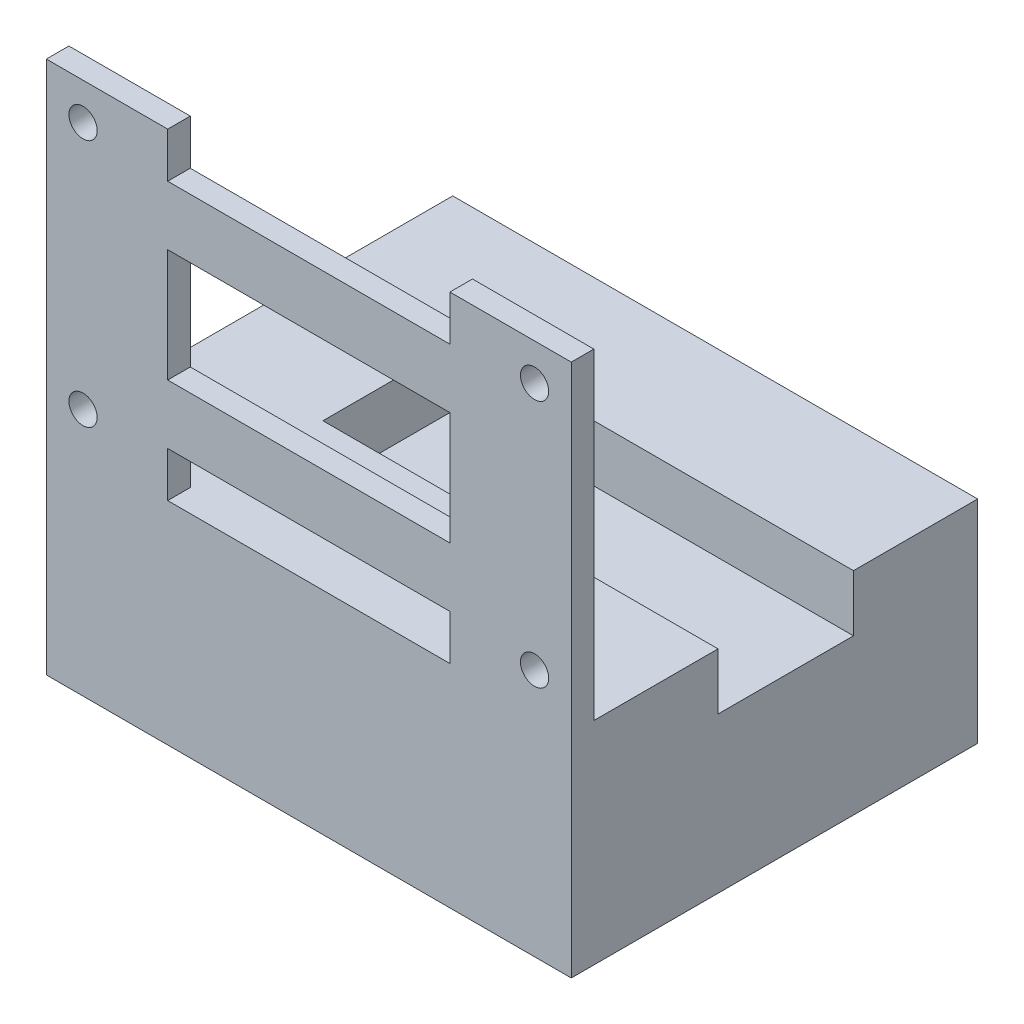
from build123d import *

# Parameters (mm, degrees)
SKETCH1_W           = 46.5
SKETCH1_H           = 34
BOSS_EXTRUDE1_DEPTH = 13.75
SKETCH2_W           = 46.5
SKETCH2_H           = 42.25
BOSS_EXTRUDE2_DEPTH = 2
CUT_EXTRUDE1_REACH  = 62.18
SKETCH3_R           = 1.25
SKETCH3_W           = 25
SKETCH3_H           = 10
SKETCH4_W           = 35
SKETCH4_H           = 12
CUT_EXTRUDE2_DEPTH  = 5
SKETCH6_W           = 46.5
SKETCH6_H           = 36
SKETCH6_R           = 2
BOSS_EXTRUDE3_DEPTH = 5
SKETCH7_W           = 25
SKETCH7_H           = 4
CUT_EXTRUDE3_DEPTH  = 10


with BuildPart() as part:
    # Sketch1 → Boss-Extrude1 (new body)
    with BuildSketch(Plane(origin=(0, 0, 0), x_dir=(1, 0, 0), z_dir=(0, 1, 0))):
        Rectangle(SKETCH1_W, SKETCH1_H)
    extrude(amount=BOSS_EXTRUDE1_DEPTH)

    # Sketch2 → Boss-Extrude2 (add)
    with BuildSketch(Plane.XY.offset(17)):
        with Locations((0, 21.125)):
            Rectangle(SKETCH2_W, SKETCH2_H)
    extrude(amount=BOSS_EXTRUDE2_DEPTH)

    # Sketch3 → Cut-Extrude1 (cut, up to next)
    with BuildSketch(Plane.XY.offset(19), mode=Mode.PRIVATE) as cut_extrude1_sk1:
        with Locations((-20, 39)):
            Circle(SKETCH3_R)
    cut_extrude1_tool1 = extrude(cut_extrude1_sk1.sketch, amount=-CUT_EXTRUDE1_REACH, mode=Mode.PRIVATE) & part.part
    # Sketch3 → Cut-Extrude1 (cut, up to next)
    with BuildSketch(Plane.XY.offset(19), mode=Mode.PRIVATE) as cut_extrude1_sk2:
        with Locations((20, 39)):
            Circle(SKETCH3_R)
    cut_extrude1_tool2 = extrude(cut_extrude1_sk2.sketch, amount=-CUT_EXTRUDE1_REACH, mode=Mode.PRIVATE) & part.part
    # Sketch3 → Cut-Extrude1 (cut, up to next)
    with BuildSketch(Plane.XY.offset(19), mode=Mode.PRIVATE) as cut_extrude1_sk3:
        with Locations((20, 17)):
            Circle(SKETCH3_R)
    cut_extrude1_tool3 = extrude(cut_extrude1_sk3.sketch, amount=-CUT_EXTRUDE1_REACH, mode=Mode.PRIVATE) & part.part
    # Sketch3 → Cut-Extrude1 (cut, up to next)
    with BuildSketch(Plane.XY.offset(19), mode=Mode.PRIVATE) as cut_extrude1_sk4:
        with Locations((-20, 17)):
            Circle(SKETCH3_R)
    cut_extrude1_tool4 = extrude(cut_extrude1_sk4.sketch, amount=-CUT_EXTRUDE1_REACH, mode=Mode.PRIVATE) & part.part
    # Sketch3 → Cut-Extrude1 (cut, up to next)
    with BuildSketch(Plane.XY.offset(19), mode=Mode.PRIVATE) as cut_extrude1_sk5:
        with Locations((0, 28)):
            Rectangle(SKETCH3_W, SKETCH3_H)
    cut_extrude1_tool5 = extrude(cut_extrude1_sk5.sketch, amount=-CUT_EXTRUDE1_REACH, mode=Mode.PRIVATE) & part.part
    add(cut_extrude1_tool1.solids().sort_by_distance((-20, 39, 19))[0], mode=Mode.SUBTRACT)
    add(cut_extrude1_tool2.solids().sort_by_distance((20, 39, 19))[0], mode=Mode.SUBTRACT)
    add(cut_extrude1_tool3.solids().sort_by_distance((20, 17, 19))[0], mode=Mode.SUBTRACT)
    add(cut_extrude1_tool4.solids().sort_by_distance((-20, 17, 19))[0], mode=Mode.SUBTRACT)
    add(cut_extrude1_tool5.solids().sort_by_distance((0, 28, 19))[0], mode=Mode.SUBTRACT)

    # Sketch4 → Cut-Extrude2 (cut)
    with BuildSketch(Plane(origin=(0, 13.75, 0), x_dir=(1, 0, 0), z_dir=(0, 1, 0))):
        with Locations((5.75, 0)):
            Rectangle(SKETCH4_W, SKETCH4_H)
    extrude(amount=-CUT_EXTRUDE2_DEPTH, mode=Mode.SUBTRACT)

    # Sketch6 → Boss-Extrude3 (add)
    with BuildSketch(Plane.XZ):
        with Locations((0, 1)):
            Rectangle(SKETCH6_W, SKETCH6_H)
        with Locations((16.25, -10)):
            Circle(SKETCH6_R, mode=Mode.SUBTRACT)
        with Locations((-16.25, -10)):
            Circle(SKETCH6_R, mode=Mode.SUBTRACT)
        with Locations((-16.25, 12)):
            Circle(SKETCH6_R, mode=Mode.SUBTRACT)
        with Locations((16.25, 12)):
            Circle(SKETCH6_R, mode=Mode.SUBTRACT)
    extrude(amount=BOSS_EXTRUDE3_DEPTH)

    # Sketch7 → Cut-Extrude3 (cut)
    with BuildSketch(Plane(origin=(0, 0, 17), x_dir=(-1, 0, 0), z_dir=(0, 0, -1))):
        with Locations((0, 15.75)):
            Rectangle(SKETCH7_W, SKETCH7_H)
        with Locations((0, 40.25)):
            Rectangle(SKETCH7_W, SKETCH7_H)
    extrude(amount=-CUT_EXTRUDE3_DEPTH, mode=Mode.SUBTRACT)


solid = part.part
